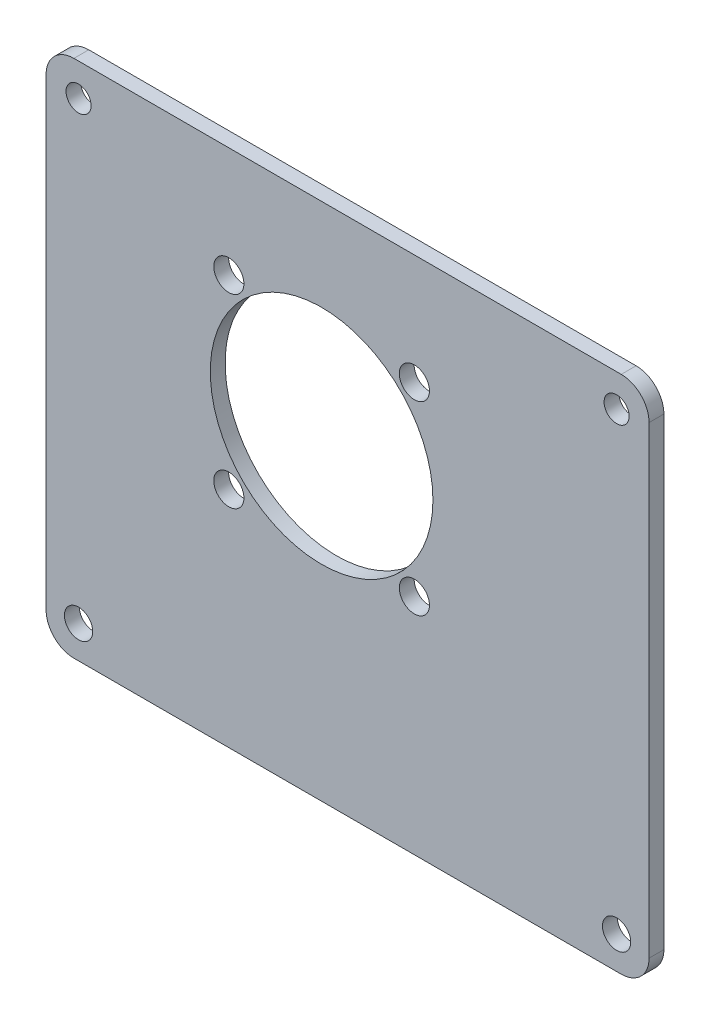
from build123d import *

# Parameters (mm, degrees)
SKETCH1_R           = 1.35
SKETCH1_R_2         = 1.524
BOSS_EXTRUDE1_DEPTH = 1.6
SKETCH2_R           = 1.625
SKETCH2_R_2         = 12
CUT_EXTRUDE1_DEPTH  = 51.919642575


with BuildPart() as part:
    # Sketch1 → Boss-Extrude1 (new body)
    with BuildSketch(Plane.XY):
        with BuildLine():
            Line((22.5, 25), (22.5, -25))
            ThreePointArc((22.5, -25), (21.621320344, -27.121320344), (19.5, -28))
            Line((19.5, -28), (-39.5, -28))
            ThreePointArc((-39.5, -28), (-41.621320344, -27.121320344), (-42.5, -25))
            Line((-42.5, -25), (-42.5, 25))
            ThreePointArc((-42.5, 25), (-41.621320344, 27.121320344), (-39.5, 28))
            Line((-39.5, 28), (19.5, 28))
            ThreePointArc((19.5, 28), (21.621320344, 27.121320344), (22.5, 25))
        make_face()
        with Locations((-39, 24.5)):
            Circle(SKETCH1_R, mode=Mode.SUBTRACT)
        with Locations((-39, -24.5)):
            Circle(SKETCH1_R_2, mode=Mode.SUBTRACT)
        with Locations((19, -24.5)):
            Circle(SKETCH1_R_2, mode=Mode.SUBTRACT)
        with Locations((19, 24.5)):
            Circle(SKETCH1_R, mode=Mode.SUBTRACT)
    extrude(amount=BOSS_EXTRUDE1_DEPTH)

    # Sketch2 → Cut-Extrude1 (cut, through all)
    with BuildSketch(Plane.XY.offset(1.6)):
        with Locations((-2.799944405, 16.10995525)):
            Circle(SKETCH2_R)
        with Locations((-22.799944405, 16.10995525)):
            Circle(SKETCH2_R)
        with Locations((-22.799944405, -3.89004475)):
            Circle(SKETCH2_R)
        with Locations((-2.799944405, -3.89004475)):
            Circle(SKETCH2_R)
        with Locations((-12.799944405, 6.10995525)):
            Circle(SKETCH2_R_2)
    extrude(amount=-CUT_EXTRUDE1_DEPTH, mode=Mode.SUBTRACT)


solid = part.part
